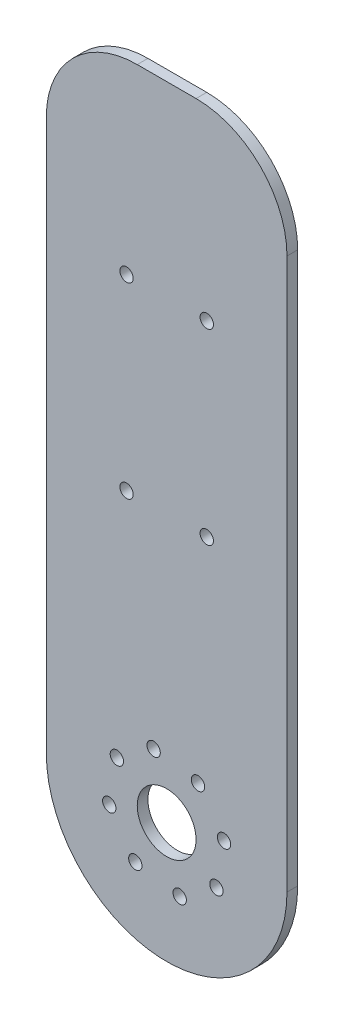
from build123d import *

# Parameters (mm, degrees)
RESSALTO_EXTRUS_O1_DEPTH = 1
ESBO_O2_R                = 5.5
CORTE_EXTRUS_O1_DEPTH    = 101.189819842
ESBO_O3_R                = 1.25
CORTE_EXTRUS_O2_DEPTH    = 101.189819842
ESBO_O8_R                = 1.25
CORTE_EXTRUS_O3_DEPTH    = 17


with BuildPart() as part:
    # Esboço1 → Ressalto-extrusão1 (new, symmetric)
    with BuildSketch(Plane.XY):
        with BuildLine():
            Line((-25, -23), (-25, 80))
            ThreePointArc((-25, 80), (-20.02081528, 92.02081528), (-8, 97))
            Line((-8, 97), (3, 97))
            ThreePointArc((3, 97), (15.02081528, 92.02081528), (20, 80))
            Line((20, 80), (20, -23))
            ThreePointArc((20, -23), (-2.5, -45.5), (-25, -23))
        make_face()
    extrude(amount=RESSALTO_EXTRUS_O1_DEPTH, both=True)

    # Esboço2 → Corte-extrusão1 (cut, through all)
    with BuildSketch(Plane(origin=(0, 0, -1), x_dir=(-1, 0, 0), z_dir=(0, 0, -1))):
        with Locations((2.5, -23)):
            Circle(ESBO_O2_R)
    extrude(amount=-CORTE_EXTRUS_O1_DEPTH, mode=Mode.SUBTRACT)

    # Esboço3 → Corte-extrusão2 (cut, through all)
    with BuildSketch(Plane(origin=(0, 0, -1), x_dir=(-1, 0, 0), z_dir=(0, 0, -1))):
        with Locations((0.062167861, -33.726461414)):
            Circle(ESBO_O3_R)
        with Locations((-6.808561241, -28.860945967)):
            Circle(ESBO_O3_R)
        with Locations((-8.226461414, -20.562167861)):
            Circle(ESBO_O3_R)
        with Locations((-3.360945967, -13.691438759)):
            Circle(ESBO_O3_R)
        with Locations((4.937832139, -12.273538586)):
            Circle(ESBO_O3_R)
        with Locations((11.808561241, -17.139054033)):
            Circle(ESBO_O3_R)
        with Locations((13.226461414, -25.437832139)):
            Circle(ESBO_O3_R)
        with Locations((8.360945967, -32.308561241)):
            Circle(ESBO_O3_R)
    extrude(amount=-CORTE_EXTRUS_O2_DEPTH, mode=Mode.SUBTRACT)

    # Esboço8 → Corte-extrusão3 (cut)
    with BuildSketch(Plane.XY.offset(1)):
        with Locations((-10, 62)):
            Circle(ESBO_O8_R)
        with Locations((-10, 27)):
            Circle(ESBO_O8_R)
        with Locations((5, 62)):
            Circle(ESBO_O8_R)
        with Locations((5, 27)):
            Circle(ESBO_O8_R)
    extrude(amount=-CORTE_EXTRUS_O3_DEPTH, mode=Mode.SUBTRACT)


solid = part.part
